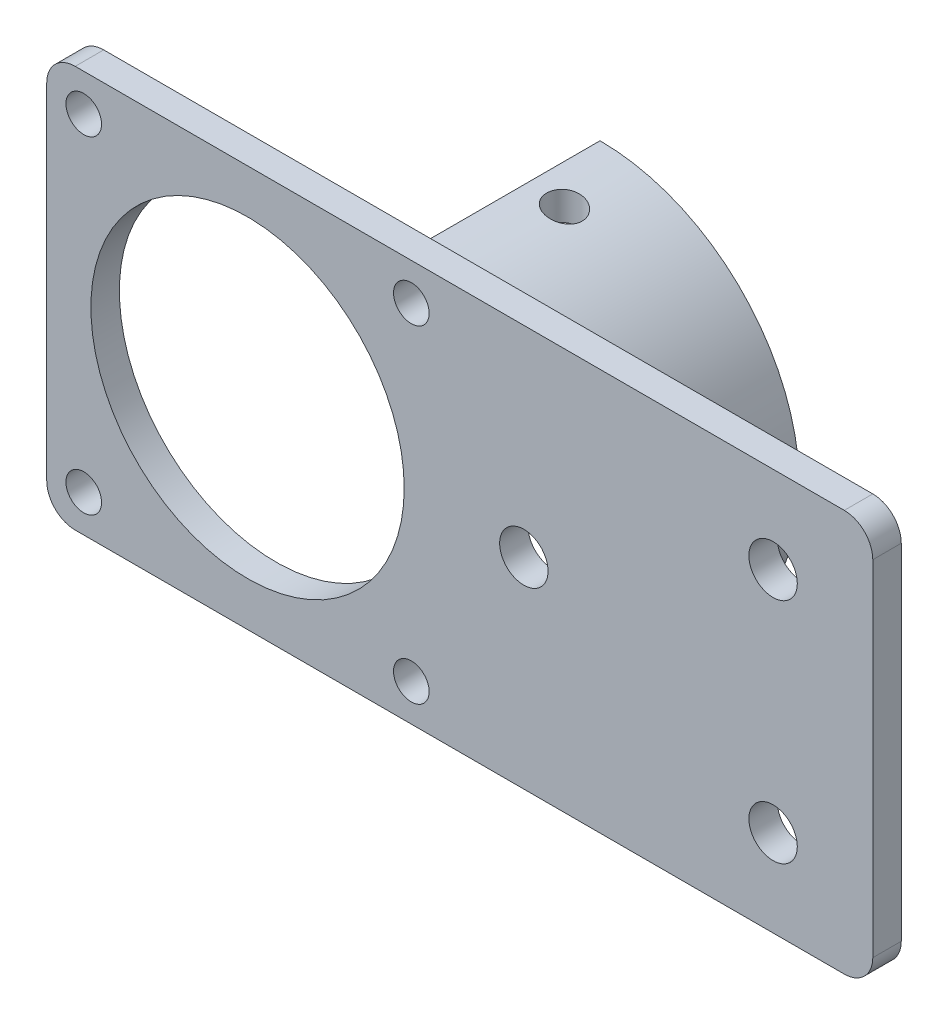
from build123d import *

# Parameters (mm, degrees)
BOSS_EXTRUDE1_DEPTH = 12
SKETCH2_W           = 58
SKETCH2_H           = 28.2
BOSS_EXTRUDE2_DEPTH = 2
SHELL2_START        = 2
SHELL2_DEPTH        = 10
SKETCH3_R           = 11
SKETCH3_R_2         = 1.25
CUT_EXTRUDE1_DEPTH  = 2
FILLET1_R           = 2
SKETCH4_R           = 1.7
CUT_EXTRUDE2_DEPTH  = 2
SKETCH5_R           = 1.7
CUT_EXTRUDE3_DEPTH  = 2
SKETCH7_R           = 1.25
CUT_EXTRUDE6_DEPTH  = 14
SKETCH8_R           = 1.25
CUT_EXTRUDE7_DEPTH  = 17


# Read off the part's stored shape, not the designer's step: Shell2
with BuildPart() as part:
    # Sketch1 → Boss-Extrude1 (new body)
    with BuildSketch(Plane.XY):
        with BuildLine():
            Line((0, 14), (0, -14))
            ThreePointArc((0, -14), (14, 0), (0, 14))
        make_face()
    extrude(amount=BOSS_EXTRUDE1_DEPTH)

    # Sketch2 → Boss-Extrude2 (add)
    with BuildSketch(Plane.XY.offset(12)):
        with Locations((4.15, 0)):
            Rectangle(SKETCH2_W, SKETCH2_H)
    extrude(amount=BOSS_EXTRUDE2_DEPTH)

    # Shell2 outline → Shell2 (cut)
    with BuildSketch(Plane.XY.offset(SHELL2_START)):
        with BuildLine():
            ThreePointArc((0, -12), (12, 0), (0, 12))
            Line((0, 12), (0, -12))
        make_face()
    extrude(amount=SHELL2_DEPTH, mode=Mode.SUBTRACT)

    # Sketch3 → Cut-Extrude1 (cut)
    with BuildSketch(Plane.XY.offset(14)):
        with Locations((-10.75, 0)):
            Circle(SKETCH3_R)
        with Locations((-22.25, 11.5)):
            Circle(SKETCH3_R_2)
        with Locations((-22.25, -11.5)):
            Circle(SKETCH3_R_2)
        with Locations(Location((0.75, -11.5, 0), (0, 0, 344.215225354))):
            Circle(SKETCH3_R_2)
        with Locations(Location((0.75, 11.5, 0), (0, 0, 15.784774646))):
            Circle(SKETCH3_R_2)
    extrude(amount=-CUT_EXTRUDE1_DEPTH, mode=Mode.SUBTRACT)

    # Fillet1
    fillet1_edges = [part.edges().sort_by_distance(p)[0] for p in [
        (-24.85, 14.1, 13),
        (-24.85, -14.1, 13),
        (33.15, -14.1, 13),
        (33.15, 14.1, 13),
    ]]
    fillet(fillet1_edges, radius=FILLET1_R)

    # Sketch4 → Cut-Extrude2 (cut)
    with BuildSketch(Plane.XY.offset(14)):
        with Locations((26.15, 8)):
            Circle(SKETCH4_R)
        with Locations((26.15, -8)):
            Circle(SKETCH4_R)
        with Locations((8.65, 0)):
            Circle(SKETCH4_R)
    extrude(amount=-CUT_EXTRUDE2_DEPTH, mode=Mode.SUBTRACT)

    # Sketch5 → Cut-Extrude3 (cut)
    with BuildSketch(Plane(origin=(0, 0, 0), x_dir=(-1, 0, 0), z_dir=(0, 0, -1))):
        with Locations((-5, -9)):
            Circle(SKETCH5_R)
        with Locations((-5, 9)):
            Circle(SKETCH5_R)
    extrude(amount=-CUT_EXTRUDE3_DEPTH, mode=Mode.SUBTRACT)

    # Sketch7 → Cut-Extrude6 (cut)
    with BuildSketch(Plane(origin=(0, 0, 0), x_dir=(0, 0, -1), z_dir=(1, 0, 0))):
        with Locations(Location((-5, 0, 0), (0, 0, 180))):
            Circle(SKETCH7_R)
    extrude(amount=CUT_EXTRUDE6_DEPTH, mode=Mode.SUBTRACT)

    # Sketch8 → Cut-Extrude7 (cut, symmetric)
    with BuildSketch(Plane(origin=(0, 0, 0), x_dir=(1, 0, 0), z_dir=(0, 1, 0))):
        with Locations(Location((2.5, -5, 0), (0, 0, 270))):
            Circle(SKETCH8_R)
    extrude(amount=CUT_EXTRUDE7_DEPTH, both=True, mode=Mode.SUBTRACT)


solid = part.part
